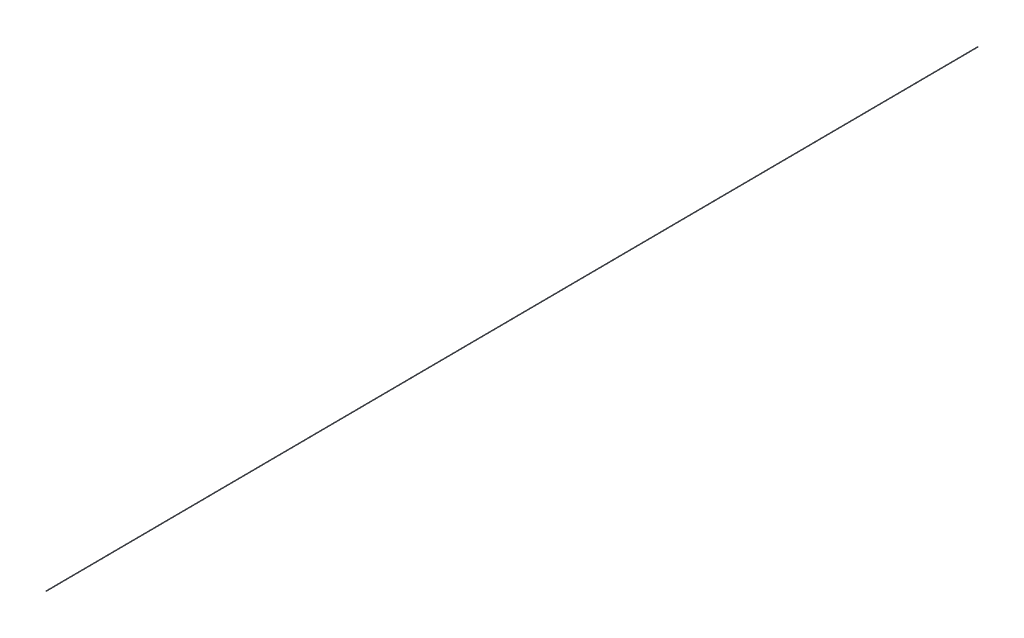
from build123d import *

# Parameters (mm, degrees)
SKETCH2_R = 3.8


with BuildPart() as part:
    # Sweep1: sweep along a path in Sketch1
    with BuildLine(Plane(origin=(0, 0, 0), x_dir=(0, 0, -1), z_dir=(1, 0, 0))) as sweep1_path:
        Line((14539.79, 85.55), (14529.79, 85.55))
        Line((14529.79, 85.55), (10, 0))
        Line((10, 0), (0, 0))
    # Sketch2 → Sweep1 (sweep)
    with BuildSketch(Plane.XY):
        Circle(SKETCH2_R)
    sweep(path=sweep1_path.line, transition=Transition.RIGHT)


solid = part.part
